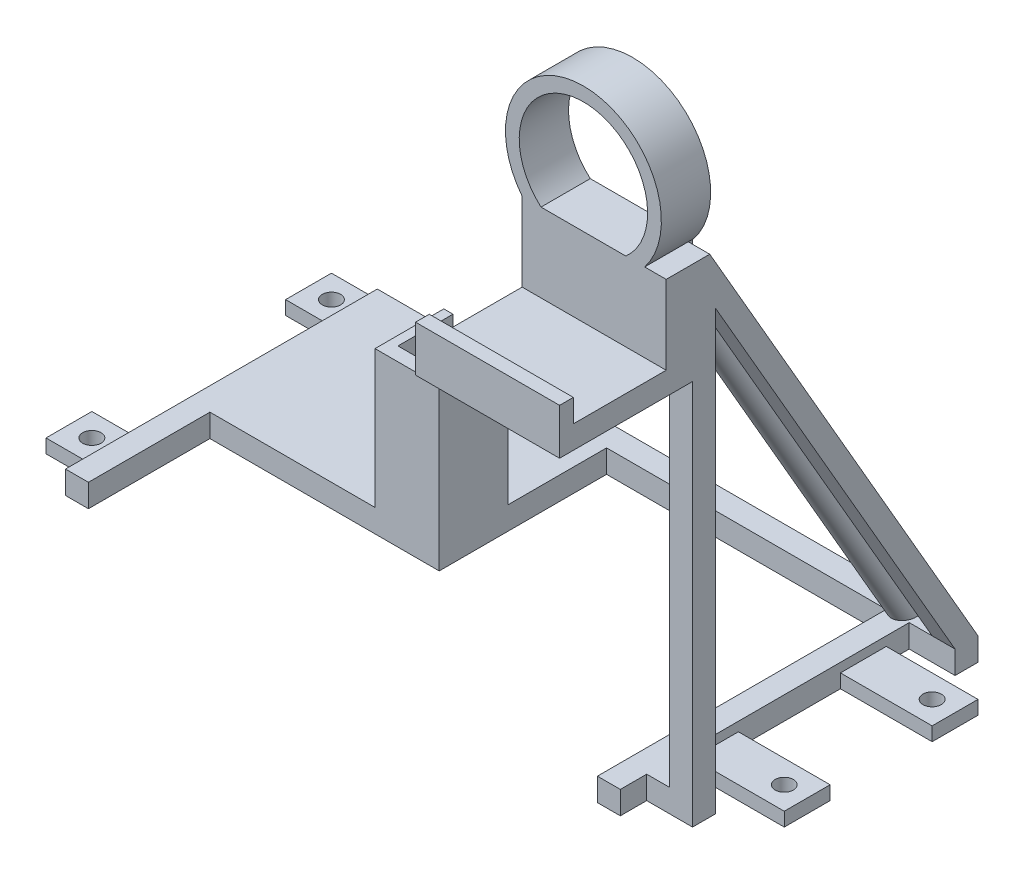
from build123d import *
from OCP.BRepAlgoAPI import BRepAlgoAPI_Cut
from OCP.TopTools import TopTools_ListOfShape

# Parameters (mm, degrees)
BOSS_EXTRUDE1_DEPTH              = 5
SKETCH2_R                        = 2.5
BOSS_EXTRUDE2_DEPTH              = 100
SKETCH3_W                        = 5
SKETCH3_H                        = 5
BOSS_EXTRUDE3_DEPTH              = 10
SKETCH5_W                        = 5
SKETCH5_H                        = 4.330127019
BOSS_EXTRUDE4_DEPTH              = 117
SKETCH6_W                        = 5
SKETCH6_H                        = 5
BOSS_EXTRUDE5_DEPTH              = 20
BOSS_EXTRUDE6_DEPTH              = 15
SKETCH9_W                        = 5
SKETCH9_H                        = 5
BOSS_EXTRUDE7_DEPTH              = 10
SKETCH10_W                       = 5
SKETCH10_H                       = 5
BOSS_EXTRUDE8_DEPTH              = 99.159909
SKETCH11_W                       = 10
SKETCH11_H                       = 3
BOSS_EXTRUDE9_DEPTH              = 10
CUT_EXTRUDE1_DEPTH               = 187.084790711
CUT_EXTRUDE1_DEPTH_BACK          = 187.084790711
SKETCH13_R                       = 2
SKETCH14_W                       = 10
SKETCH14_H                       = 3
BOSS_EXTRUDE10_DEPTH             = 20
CUT_EXTRUDE2_DEPTH               = 194.255140511
CUT_EXTRUDE2_DEPTH_BACK          = 194.255140511
SKETCH15_R                       = 2
BOSS_EXTRUDE11_DEPTH             = 7.8
CUT_EXTRUDE3_DEPTH               = 187.016127587
CUT_EXTRUDE3_DEPTH_BACK          = 187.016127587
SKETCH17_W                       = 22.17902444
SKETCH17_H                       = 20
BOSS_EXTRUDE12_DEPTH             = 5.75
BOSS_EXTRUDE12_DEPTH_BACK        = 5
SKETCH19_W                       = 1.5
SKETCH19_H                       = 10.75
BOSS_EXTRUDE13_DEPTH             = 2.742414
SKETCH21_W                       = 1.5
SKETCH21_H                       = 1
BOSS_EXTRUDE15_DEPTH             = 1
BOSS_EXTRUDE17_REACH             = 195.512
CUT_EXTRUDE4_START               = 2
SKETCH23_W                       = 7.8
SKETCH23_H                       = 12
CUT_EXTRUDE4_DEPTH               = 10
BOSS_EXTRUDE19_DEPTH             = 5
BOSS_EXTRUDE19_DEPTH_BACK        = 2.165064
SKETCH23_2_W                     = 7.8
SKETCH23_2_H                     = 12
CUT_EXTRUDE5_DEPTH               = 1.25
BOSS_EXTRUDE20_REACH             = 188.016
SKETCH25_W                       = 5
SKETCH25_H                       = 4.330127019
SKETCH26_W                       = 5
SKETCH26_H                       = 2.16506351
CUT_EXTRUDE6_DEPTH               = 5
SKETCH27_W                       = 5.75
SKETCH27_H                       = 7.16506351
BOSS_EXTRUDE21_DEPTH             = 5
SKETCH29_W                       = 3
SKETCH29_H                       = 30
BOSS_EXTRUDE22_DEPTH             = 55
SKETCH30_W                       = 5
SKETCH30_H                       = 3
BOSS_EXTRUDE23_DEPTH             = 5
SKETCH31_W                       = 5
SKETCH31_H                       = 5
BOSS_EXTRUDE24_DEPTH             = 33.5
SKETCH32_W                       = 2
SKETCH32_H                       = 19
BOSS_EXTRUDE25_DEPTH             = 12
SKETCH34_W                       = 41
SKETCH34_H                       = 3
CUT_EXTRUDE7_DEPTH               = 30
SKETCH35_W                       = 14
SKETCH35_H                       = 12
BOSS_EXTRUDE26_DEPTH             = 7
BOSS_EXTRUDE27_REACH             = 187.154
SKETCH36_W                       = 9
SKETCH36_H                       = 5
BOSS_EXTRUDE27_DIRECTION_2_REACH = 187.154
SKETCH37_W                       = 41.5
SKETCH37_H                       = 5
BOSS_EXTRUDE28_DEPTH             = 41
SKETCH38_W                       = 34.251665069
SKETCH38_H                       = 27.087918127
CUT_EXTRUDE8_DEPTH               = 185.330721404
SKETCH39_W                       = 67.684653824
SKETCH39_H                       = 30.030202731
CUT_EXTRUDE9_DEPTH               = 190.235302527
SKETCH44_W                       = 5
SKETCH44_H                       = 7.16506351
BOSS_EXTRUDE30_DEPTH             = 18.612596
BOSS_EXTRUDE31_DEPTH             = 10.75
BOSS_EXTRUDE32_DEPTH             = 5.75
SKETCH46_W                       = 5
SKETCH46_H                       = 5
EDIT_THIS_LENGTH_DEPTH           = 29
SKETCH47_W                       = 5
SKETCH47_H                       = 3
BOSS_EXTRUDE34_DEPTH             = 5
BOSS_EXTRUDE35_REACH             = 197.039
SKETCH48_W                       = 26.412596329
SKETCH48_H                       = 5.25
SKETCH50_W                       = 5
SKETCH50_H                       = 5.75
BOSS_EXTRUDE36_DEPTH             = 10
BOSS_EXTRUDE37_DEPTH             = 26.412596329
CHAMFER1_SIZE                    = 16
CHAMFER1_SIZE2                   = 1.399818616


with BuildPart() as part:
    # Sketch1 → Boss-Extrude1 (new body)
    with BuildSketch(Plane(origin=(0, 0, 0), x_dir=(1, 0, 0), z_dir=(0, 1, 0))):
        Polygon((121, 0), (0, 0), (0, -68), (5, -68), (5, -5), (116, -5), (116, -68), (121, -68), align=None)
    extrude(amount=BOSS_EXTRUDE1_DEPTH)

    # Sketch2 → Boss-Extrude2 (add)
    with BuildSketch(Plane(origin=(0, 3.75, 2.165063509), x_dir=(1, 0, 0), z_dir=(0, 0.866025403784438, 0.500000000000001))):
        with Locations(Location((118.200131686, -0.299868314, 0), (0, 0, 90))):
            Circle(SKETCH2_R)
    extrude(amount=BOSS_EXTRUDE2_DEPTH)

    # Sketch3 → Boss-Extrude3 (add)
    with BuildSketch(Plane(origin=(121, 0, 0), x_dir=(0, 0, -1), z_dir=(1, 0, 0))):
        with Locations((-2.5, 2.5)):
            Rectangle(SKETCH3_W, SKETCH3_H)
    extrude(amount=BOSS_EXTRUDE3_DEPTH)

    # Sketch5 → Boss-Extrude4 (add)
    with BuildSketch(Plane(origin=(0, 3.75, 2.165063509), x_dir=(1, 0, 0), z_dir=(0, 0.866025403784438, 0.500000000000001))):
        with Locations((128.5, 0.33493649)):
            Rectangle(SKETCH5_W, SKETCH5_H)
    extrude(amount=BOSS_EXTRUDE4_DEPTH)

    # Sketch6 → Boss-Extrude5 (add)
    with BuildSketch(Plane(origin=(0, 1.25, -2.165063509), x_dir=(-1, 0, 0), z_dir=(0, 0.5000000000000009, -0.866025403784438))):
        with Locations((-128.5, 118.830127019)):
            Rectangle(SKETCH6_W, SKETCH6_H)
    extrude(amount=BOSS_EXTRUDE5_DEPTH)

    # Sketch7 → Boss-Extrude6 (add)
    with BuildSketch(Plane.ZY.offset(-126)):
        Polygon((45.509618943, 113.824972243), (41.179491924, 116.324972243), (38.679491924, 111.994845224), (43.009618943, 109.494845224), align=None)
    extrude(amount=BOSS_EXTRUDE6_DEPTH)

    # Sketch9 → Boss-Extrude7 (add)
    with BuildSketch(Plane(origin=(121, 0, 0), x_dir=(0, 0, -1), z_dir=(1, 0, 0))):
        with Locations((-59.75, 2.5)):
            Rectangle(SKETCH9_W, SKETCH9_H)
    extrude(amount=BOSS_EXTRUDE7_DEPTH)

    # Sketch10 → Boss-Extrude8 (add)
    with BuildSketch(Plane(origin=(0, 5, 0), x_dir=(1, 0, 0), z_dir=(0, 1, 0))):
        with Locations((128.5, -59.75)):
            Rectangle(SKETCH10_W, SKETCH10_H)
    extrude(amount=BOSS_EXTRUDE8_DEPTH)

    # Sketch11 → Boss-Extrude9 (add)
    with BuildSketch(Plane.ZY):
        with Locations((57.25, 1.5)):
            Rectangle(SKETCH11_W, SKETCH11_H)
        with Locations((5, 1.5)):
            Rectangle(SKETCH11_W, SKETCH11_H)
    extrude(amount=BOSS_EXTRUDE9_DEPTH)

    # Sketch13 → Cut-Extrude1 (cut, two sides: drawn at the far end of the back side and taken through both)
    with BuildSketch(Plane(origin=(0, 3, 0), x_dir=(1, 0, 0), z_dir=(0, 1, 0)).offset(-CUT_EXTRUDE1_DEPTH_BACK)):
        with Locations(Location((-5, -5, 0), (0, 0, 270))):
            Circle(SKETCH13_R)
        with Locations(Location((-5, -57.25, 0), (0, 0, 270))):
            Circle(SKETCH13_R)
    extrude(amount=CUT_EXTRUDE1_DEPTH + CUT_EXTRUDE1_DEPTH_BACK, mode=Mode.SUBTRACT)

    # Sketch14 → Boss-Extrude10 (add)
    with BuildSketch(Plane(origin=(121, 0, 0), x_dir=(0, 0, -1), z_dir=(1, 0, 0))):
        with Locations((-15, 1.5)):
            Rectangle(SKETCH14_W, SKETCH14_H)
        with Locations((-47.25, 1.5)):
            Rectangle(SKETCH14_W, SKETCH14_H)
    extrude(amount=BOSS_EXTRUDE10_DEPTH)

    # Sketch15 → Cut-Extrude2 (cut, two sides: drawn at the far end of the back side and taken through both)
    with BuildSketch(Plane(origin=(0, 3, 0), x_dir=(1, 0, 0), z_dir=(0, 1, 0)).offset(-CUT_EXTRUDE2_DEPTH_BACK)):
        with Locations(Location((136, -15, 0), (0, 0, 270))):
            Circle(SKETCH15_R)
        with Locations(Location((136, -47.25, 0), (0, 0, 270))):
            Circle(SKETCH15_R)
    extrude(amount=CUT_EXTRUDE2_DEPTH + CUT_EXTRUDE2_DEPTH_BACK, mode=Mode.SUBTRACT)

    # Sketch16 → Boss-Extrude11 (add)
    with BuildSketch(Plane.ZY.offset(-126)):
        Polygon((49.839745962, 111.324972243), (67, 101.417494955), (64.5, 97.087367936), (47.339745962, 106.994845224), align=None)
    extrude(amount=BOSS_EXTRUDE11_DEPTH)

    # Sketch17 → Cut-Extrude3 (cut, two sides: drawn at the far end of the back side and taken through both)
    with BuildSketch(Plane(origin=(0, 105.074972243, 60.665063509), x_dir=(1, 0, 0), z_dir=(0, 0.8660254037844382, 0.500000000000001)).offset(-CUT_EXTRUDE3_DEPTH_BACK)):
        with Locations((119.91048778, 12.5)):
            Rectangle(SKETCH17_W, SKETCH17_H)
    extrude(amount=CUT_EXTRUDE3_DEPTH + CUT_EXTRUDE3_DEPTH_BACK, mode=Mode.SUBTRACT)



with BuildPart() as body_2:
    # Sketch18 → Boss-Extrude12 (new, two sides: drawn at the far end of the back side and taken through both)
    with BuildSketch(Plane.XY.offset(62.25).offset(-BOSS_EXTRUDE12_DEPTH_BACK)):
        with BuildLine():
            Line((118.2, 104.159908733), (119.7, 104.159908733))
            ThreePointArc((119.7, 104.159908733), (110.2, 113.659908733), (100.7, 104.159908733))
            Line((100.7, 104.159908733), (102.2, 104.159908733))
            ThreePointArc((102.2, 104.159908733), (110.2, 112.159908733), (118.2, 104.159908733))
        make_face()
    extrude(amount=BOSS_EXTRUDE12_DEPTH + BOSS_EXTRUDE12_DEPTH_BACK)


with BuildPart() as part_1:
    add(part.part)

    add(body_2.part)  # Boss-Extrude13 merges body 2
    # Sketch19 → Boss-Extrude13 (add)
    with BuildSketch(Plane.XZ.offset(-104.159908733)):
        with Locations((118.95, 62.625)):
            Rectangle(SKETCH19_W, SKETCH19_H)
    extrude(amount=BOSS_EXTRUDE13_DEPTH)

    # Sketch21 → Boss-Extrude15 (add)
    with BuildSketch(Plane.XZ.offset(-101.417494955)):
        with Locations((118.95, 67.5)):
            Rectangle(SKETCH21_W, SKETCH21_H)
    extrude(amount=BOSS_EXTRUDE15_DEPTH)

    # Boss-Extrude17: up to this plane
    boss_extrude17_end = Plane(origin=(119.7, 101.417494955, 68), z_dir=(0, 0, -1))
    # Sketch20 → Boss-Extrude17 (add, up to the surface)
    with BuildSketch(Plane(origin=(0, -3.657477288, 6.334936491), x_dir=(1, 0, 0), z_dir=(0, -0.5000000000000039, 0.8660254037844365)), mode=Mode.PRIVATE) as boss_extrude17_sk1:
        Polygon((126, 116.330127019), (126, 121.330127019), (119.7, 121.330127019), (118.2, 121.330127019), (118.2, 116.330127019), align=None)
    boss_extrude17_tool1 = split(extrude(boss_extrude17_sk1.sketch, amount=BOSS_EXTRUDE17_REACH, mode=Mode.PRIVATE), bisect_by=boss_extrude17_end, keep=Keep.BOTH, mode=Mode.PRIVATE)
    add(boss_extrude17_tool1.solids().sort_by_distance((122.1, 99.252431, 65.75))[0])

    # Sketch23 → Cut-Extrude4 (cut)
    with BuildSketch(Plane(origin=(0, 104.159908733, 0), x_dir=(-1, 0, 0), z_dir=(0, -1, 0)).offset(CUT_EXTRUDE4_START)):
        with Locations((-122.1, -62)):
            Rectangle(SKETCH23_W, SKETCH23_H)
    extrude(amount=CUT_EXTRUDE4_DEPTH, mode=Mode.SUBTRACT)

    # Sketch23<2> → Boss-Extrude19 (add, two sides: drawn at the far end of the back side and taken through both)
    with BuildSketch(Plane(origin=(0, 104.159908733, 0), x_dir=(-1, 0, 0), z_dir=(0, -1, 0)).offset(-BOSS_EXTRUDE19_DEPTH_BACK)):
        with Locations((-122.1, -62)):
            Rectangle(SKETCH23_2_W, SKETCH23_2_H)
    extrude(amount=BOSS_EXTRUDE19_DEPTH + BOSS_EXTRUDE19_DEPTH_BACK)


with BuildPart() as cut_extrude5_tool:
    # Sketch24 → Cut-Extrude5 (new body)
    with BuildSketch(Plane(origin=(0, 0, 56), x_dir=(-1, 0, 0), z_dir=(0, 0, -1))):
        Polygon((-126, 106.324972243), (-126, 101.994845224), (-126, 99.159908733), (-118.2, 99.159908733), (-118.2, 106.324972243), align=None)
    extrude(amount=-CUT_EXTRUDE5_DEPTH)


with BuildPart() as part_2:
    add(part_1.part)

    # Cut-Extrude5: cut by cut_extrude5_tool, with a tolerance
    cut_extrude5_stock = TopTools_ListOfShape()
    cut_extrude5_stock.Append(part_2.part.wrapped)
    cut_extrude5_tools = TopTools_ListOfShape()
    cut_extrude5_tools.Append(cut_extrude5_tool.part.wrapped)
    cut_extrude5_cut = BRepAlgoAPI_Cut()
    cut_extrude5_cut.SetArguments(cut_extrude5_stock)
    cut_extrude5_cut.SetTools(cut_extrude5_tools)
    cut_extrude5_cut.SetFuzzyValue(0.00001)
    cut_extrude5_cut.Build()
    add(Compound.cast(cut_extrude5_cut.Shape()).solids(), mode=Mode.REPLACE)

    # Boss-Extrude20: up to this face of the body (flat: up to its plane)
    boss_extrude20_end = Plane(part_2.part.faces().sort_by_distance((122.724999943, 106.324972733, 62.625))[0])
    # Sketch25 → Boss-Extrude20 (add, up to the picked face)
    with BuildSketch(Plane(origin=(0, 105.074972243, 60.665063509), x_dir=(1, 0, 0), z_dir=(0, 0.8660254037844382, 0.500000000000001)), mode=Mode.PRIVATE) as boss_extrude20_sk1:
        with Locations((128.5, 0.33493649)):
            Rectangle(SKETCH25_W, SKETCH25_H)
    boss_extrude20_tool1 = split(extrude(boss_extrude20_sk1.sketch, amount=BOSS_EXTRUDE20_REACH, mode=Mode.PRIVATE), bisect_by=boss_extrude20_end, keep=Keep.BOTH, mode=Mode.PRIVATE)
    add(boss_extrude20_tool1.solids().sort_by(Axis((128.5, 105.24244, 60.375), (0, 0.8660254037844382, 0.500000000000001)))[0])


with BuildPart() as cut_extrude6_tool:
    # Sketch26 → Cut-Extrude6 (new body)
    with BuildSketch(Plane.XY.offset(62.25)):
        with Locations((128.5, 105.242440488)):
            Rectangle(SKETCH26_W, SKETCH26_H)
    extrude(amount=CUT_EXTRUDE6_DEPTH)


with BuildPart() as part_3:
    add(part_2.part)

    # Cut-Extrude6: cut by cut_extrude6_tool, with a tolerance
    cut_extrude6_stock = TopTools_ListOfShape()
    cut_extrude6_stock.Append(part_3.part.wrapped)
    cut_extrude6_tools = TopTools_ListOfShape()
    cut_extrude6_tools.Append(cut_extrude6_tool.part.wrapped)
    cut_extrude6_cut = BRepAlgoAPI_Cut()
    cut_extrude6_cut.SetArguments(cut_extrude6_stock)
    cut_extrude6_cut.SetTools(cut_extrude6_tools)
    cut_extrude6_cut.SetFuzzyValue(0.00001)
    cut_extrude6_cut.Build()
    add(Compound.cast(cut_extrude6_cut.Shape()).solids(), mode=Mode.REPLACE)

    # Sketch27 → Boss-Extrude21 (add)
    with BuildSketch(Plane(origin=(126, 0, 0), x_dir=(0, 0, -1), z_dir=(1, 0, 0))):
        with Locations((-65.125, 102.742440488)):
            Rectangle(SKETCH27_W, SKETCH27_H)
    extrude(amount=BOSS_EXTRUDE21_DEPTH)

    # Sketch29 → Boss-Extrude22 (add)
    with BuildSketch(Plane.ZY):
        with Locations((40, 20)):
            Rectangle(SKETCH29_W, SKETCH29_H)
    extrude(amount=-BOSS_EXTRUDE22_DEPTH)

    # Sketch30 → Boss-Extrude23 (add)
    with BuildSketch(Plane.XZ.offset(-5)):
        with Locations((52.5, 40)):
            Rectangle(SKETCH30_W, SKETCH30_H)
    extrude(amount=BOSS_EXTRUDE23_DEPTH)

    # Sketch31 → Boss-Extrude24 (add)
    with BuildSketch(Plane(origin=(0, 0, 38.5), x_dir=(-1, 0, 0), z_dir=(0, 0, -1))):
        with Locations((-52.5, 2.5)):
            Rectangle(SKETCH31_W, SKETCH31_H)
    extrude(amount=BOSS_EXTRUDE24_DEPTH)

    # Sketch32 → Boss-Extrude25 (add)
    with BuildSketch(Plane(origin=(0, 0, 38.5), x_dir=(-1, 0, 0), z_dir=(0, 0, -1))):
        Polygon((-41, 9), (-53, 9), (-53, 35), (-55, 35), (-55, 7), (-41, 7), align=None)
        with Locations((-42, 25.5)):
            Rectangle(SKETCH32_W, SKETCH32_H)
    extrude(amount=BOSS_EXTRUDE25_DEPTH)

    # Sketch34 → Cut-Extrude7 (cut)
    with BuildSketch(Plane(origin=(0, 35, 0), x_dir=(1, 0, 0), z_dir=(0, 1, 0))):
        with Locations((20.5, -40)):
            Rectangle(SKETCH34_W, SKETCH34_H)
    extrude(amount=-CUT_EXTRUDE7_DEPTH, mode=Mode.SUBTRACT)

    # Sketch35 → Boss-Extrude26 (add)
    with BuildSketch(Plane.XZ.offset(-7)):
        with Locations((48, 32.5)):
            Rectangle(SKETCH35_W, SKETCH35_H)
    extrude(amount=BOSS_EXTRUDE26_DEPTH)

    # Boss-Extrude27: up to this face of the body (flat: up to its plane)
    boss_extrude27_end = Plane(part_3.part.faces().sort_by_distance((48.252808989, 19.016853933, 41.5))[0])
    # Sketch36 → Boss-Extrude27 (add, up to the picked face)
    with BuildSketch(Plane.XY.offset(38.5), mode=Mode.PRIVATE) as boss_extrude27_sk1:
        with Locations((45.5, 2.5)):
            Rectangle(SKETCH36_W, SKETCH36_H)
    boss_extrude27_tool1 = split(extrude(boss_extrude27_sk1.sketch, amount=BOSS_EXTRUDE27_REACH, mode=Mode.PRIVATE), bisect_by=boss_extrude27_end, keep=Keep.BOTH, mode=Mode.PRIVATE)
    add(boss_extrude27_tool1.solids().sort_by(Axis((45.5, 2.5, 38.5), (0, 0, 1)))[0])

    # Boss-Extrude27 direction 2: up to this face of the body (flat: up to its plane)
    boss_extrude27_direction_2_end = Plane(part_3.part.faces().sort_by_distance((27.5, 2.5, 5))[0])
    # Sketch36 → Boss-Extrude27 direction 2 (add, up to the picked face)
    with BuildSketch(Plane.XY.offset(38.5), mode=Mode.PRIVATE) as boss_extrude27_direction_2_sk1:
        with Locations((45.5, 2.5)):
            Rectangle(SKETCH36_W, SKETCH36_H)
    boss_extrude27_direction_2_tool1 = split(extrude(boss_extrude27_direction_2_sk1.sketch, amount=-BOSS_EXTRUDE27_DIRECTION_2_REACH, mode=Mode.PRIVATE), bisect_by=boss_extrude27_direction_2_end, keep=Keep.BOTH, mode=Mode.PRIVATE)
    add(boss_extrude27_direction_2_tool1.solids().sort_by(Axis((45.5, 2.5, 38.5), (0, 0, -1)))[0])

    # Sketch37 → Boss-Extrude28 (add)
    with BuildSketch(Plane.ZY.offset(-41)):
        with Locations((20.75, 2.5)):
            Rectangle(SKETCH37_W, SKETCH37_H)
    extrude(amount=BOSS_EXTRUDE28_DEPTH)

    # Sketch38 → Cut-Extrude8 (cut, through all)
    with BuildSketch(Plane.ZY.offset(-118.2)):
        with Locations((61.183105348, 109.662346151)):
            Rectangle(SKETCH38_W, SKETCH38_H)
    extrude(amount=CUT_EXTRUDE8_DEPTH, mode=Mode.SUBTRACT)

    # Sketch39 → Cut-Extrude9 (cut, through all)
    with BuildSketch(Plane(origin=(0, 106.324972243, 0), x_dir=(1, 0, 0), z_dir=(0, 1, 0))):
        with Locations((120.498501698, -57.225220953)):
            Rectangle(SKETCH39_W, SKETCH39_H)
    extrude(amount=CUT_EXTRUDE9_DEPTH, mode=Mode.SUBTRACT)

    # Sketch44 → Boss-Extrude30 (add)
    with BuildSketch(Plane.ZY.offset(-118.2)):
        with Locations((59.75, 102.742440488)):
            Rectangle(SKETCH44_W, SKETCH44_H)
    extrude(amount=BOSS_EXTRUDE30_DEPTH)

    # Sketch43 → Boss-Extrude31 (add)
    with BuildSketch(Plane(origin=(0, 0, 57.25), x_dir=(-1, 0, 0), z_dir=(0, 0, -1))):
        with BuildLine():
            Line((-122.200131686, 106.324972243), (-126, 106.324972243))
            Line((-126, 106.324972243), (-126.312859701, 106.324972243))
            ThreePointArc((-126.312859701, 106.324972243), (-112.950131686, 133.833897021), (-99.587403671, 106.324972243))
            Line((-99.587403671, 106.324972243), (-103.700131686, 106.324972243))
            ThreePointArc((-103.700131686, 106.324972243), (-112.950131686, 130.833897021), (-122.200131686, 106.324972243))
        make_face()
    extrude(amount=-BOSS_EXTRUDE31_DEPTH)

    # Sketch45 → Boss-Extrude32 (add)
    with BuildSketch(Plane.XY.offset(62.25)):
        Polygon((118.2, 99.159908733), (118.2, 106.324972243), (103.700131686, 106.324972243), (99.587403671, 106.324972243), (99.587403671, 99.159908733), align=None)
    extrude(amount=BOSS_EXTRUDE32_DEPTH)

    # Sketch46 → EDIT THIS LENGTH (add)
    with BuildSketch(Plane.XY.offset(62.25)):
        with Locations((128.5, 86.659908733)):
            Rectangle(SKETCH46_W, SKETCH46_H)
    extrude(amount=EDIT_THIS_LENGTH_DEPTH)

    # Sketch47 → Boss-Extrude34 (add)
    with BuildSketch(Plane(origin=(0, 89.159908733, 0), x_dir=(1, 0, 0), z_dir=(0, 1, 0))):
        with Locations((128.5, -89.75)):
            Rectangle(SKETCH47_W, SKETCH47_H)
    extrude(amount=BOSS_EXTRUDE34_DEPTH)

    # Boss-Extrude35: up to this face of the body (flat: up to its plane)
    boss_extrude35_end = Plane(part_3.part.faces().sort_by_distance((128.5, 84.159908733, 76.75))[0])
    # Sketch48 → Boss-Extrude35 (add, up to the picked face)
    with BuildSketch(Plane.XZ.offset(-99.159908733), mode=Mode.PRIVATE) as boss_extrude35_sk1:
        with Locations((112.793701836, 65.375)):
            Rectangle(SKETCH48_W, SKETCH48_H)
    boss_extrude35_tool1 = split(extrude(boss_extrude35_sk1.sketch, amount=BOSS_EXTRUDE35_REACH, mode=Mode.PRIVATE), bisect_by=boss_extrude35_end, keep=Keep.BOTH, mode=Mode.PRIVATE)
    add(boss_extrude35_tool1.solids().sort_by(Axis((112.793702, 99.159909, 65.375), (0, -1, 0)))[0])

    # Sketch50 → Boss-Extrude36 (add)
    with BuildSketch(Plane.XZ.offset(-99.159908733)):
        with Locations((128.5, 65.125)):
            Rectangle(SKETCH50_W, SKETCH50_H)
    extrude(amount=BOSS_EXTRUDE36_DEPTH)

    # Sketch51 → Boss-Extrude37 (add)
    with BuildSketch(Plane.ZY.offset(-126)):
        Polygon((68, 89.159908733), (68, 84.159908733), (91.25, 84.159908733), (91.25, 94.159908733), (88.25, 94.159908733), (88.25, 89.159908733), align=None)
    extrude(amount=BOSS_EXTRUDE37_DEPTH)

    # Chamfer1
    chamfer1_edges = [part_3.edges().sort_by_distance(p)[0] for p in [
        (99.587404, 99.159908733, 59.75),
    ]]
    chamfer1_side = [part_3.faces().sort_by_distance(p)[0] for p in [
        (112.793702, 99.159908733, 60),
    ]]
    chamfer(chamfer1_edges, length=CHAMFER1_SIZE, length2=CHAMFER1_SIZE2, reference=chamfer1_side[0])


solid = part_3.part
